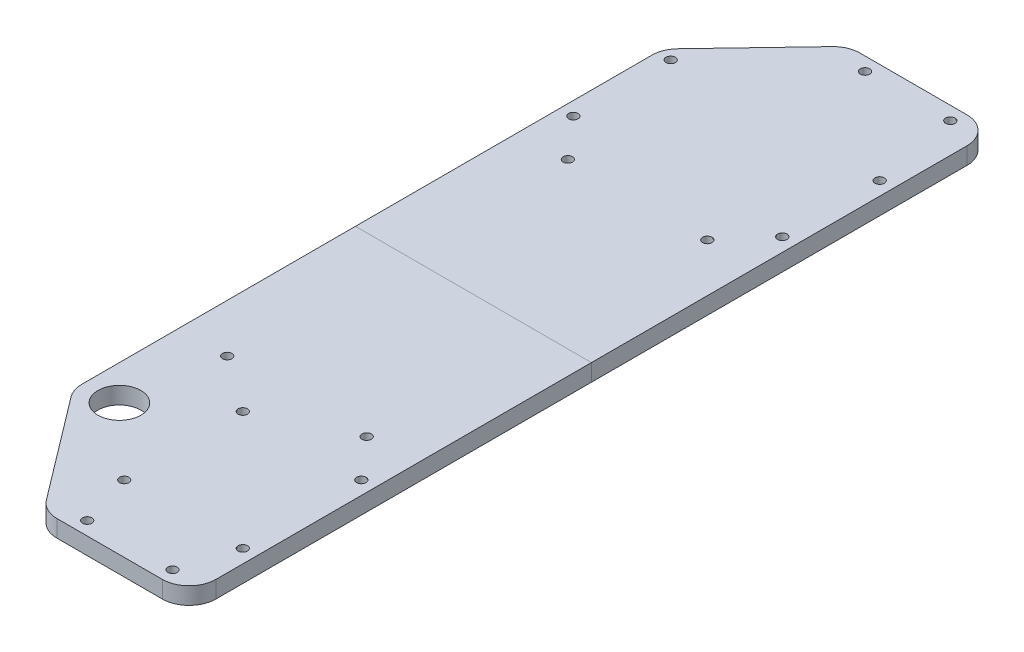
from build123d import *

# Parameters (mm, degrees)
SKETCH1_R           = 8
SKETCH1_R_2         = 1.75
BOSS_EXTRUDE1_DEPTH = 6.35
FILLET1_R           = 10


with BuildPart() as part:
    # Sketch1 → Boss-Extrude1 (new body)
    with BuildSketch(Plane(origin=(0, 0, 0), x_dir=(1, 0, 0), z_dir=(0, 1, 0))):
        Polygon((0, 44.633081493), (33.8, 0), (88, 0), (88, 300), (33.8, 300), (0, 264.520429961), align=None)
        with Locations((13, 49)):
            Circle(SKETCH1_R, mode=Mode.SUBTRACT)
        with Locations((38.8, 25)):
            Circle(SKETCH1_R_2, mode=Mode.SUBTRACT)
        with Locations((38.8, 69.2)):
            Circle(SKETCH1_R_2, mode=Mode.SUBTRACT)
        with Locations((18, 84.2)):
            Circle(SKETCH1_R_2, mode=Mode.SUBTRACT)
        with Locations((45, 5)):
            Circle(SKETCH1_R_2, mode=Mode.SUBTRACT)
        with Locations((76.8, 5)):
            Circle(SKETCH1_R_2, mode=Mode.SUBTRACT)
        with Locations((83, 25)):
            Circle(SKETCH1_R_2, mode=Mode.SUBTRACT)
        with Locations((83, 69.2)):
            Circle(SKETCH1_R_2, mode=Mode.SUBTRACT)
        with Locations((70, 84.2)):
            Circle(SKETCH1_R_2, mode=Mode.SUBTRACT)
        with Locations((18, 211.2)):
            Circle(SKETCH1_R_2, mode=Mode.SUBTRACT)
        with Locations((5.05, 226.2)):
            Circle(SKETCH1_R_2, mode=Mode.SUBTRACT)
        with Locations((5.05, 262.5)):
            Circle(SKETCH1_R_2, mode=Mode.SUBTRACT)
        with Locations((70, 211.2)):
            Circle(SKETCH1_R_2, mode=Mode.SUBTRACT)
        with Locations((45, 295)):
            Circle(SKETCH1_R_2, mode=Mode.SUBTRACT)
        with Locations((82.95, 226.2)):
            Circle(SKETCH1_R_2, mode=Mode.SUBTRACT)
        with Locations((76.8, 295)):
            Circle(SKETCH1_R_2, mode=Mode.SUBTRACT)
        with Locations((82.95, 262.5)):
            Circle(SKETCH1_R_2, mode=Mode.SUBTRACT)
    extrude(amount=BOSS_EXTRUDE1_DEPTH)

    # Fillet1
    fillet1_edges = [part.edges().sort_by_distance(p)[0] for p in [
        (88, 3.175, -300),
        (88, 3.175, 0),
        (33.8, 3.175, 0),
        (0, 3.175, -44.633081493),
        (33.8, 3.175, -300),
        (0, 3.175, -264.520429961),
    ]]
    fillet(fillet1_edges, radius=FILLET1_R)


with BuildPart() as body_2:
    # Split1: the piece on the far side of the plane
    add(part.part)
    split(bisect_by=Plane.XY.offset(-150), keep=Keep.BOTTOM)


with BuildPart() as part_1:
    add(part.part)

    # Split1
    split(bisect_by=Plane.XY.offset(-150), keep=Keep.TOP)


solid = Compound([body_2.part, part_1.part])
